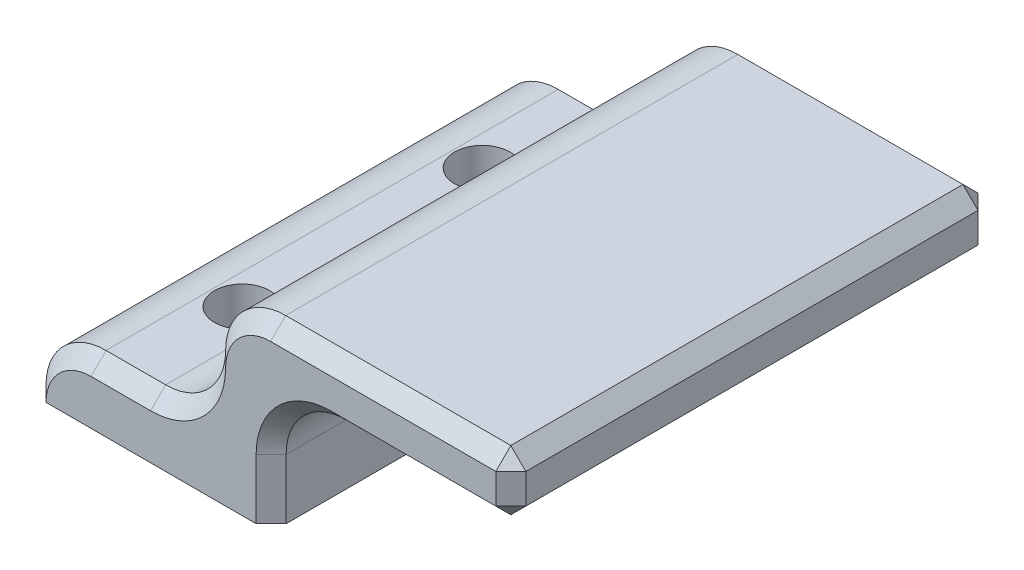
from build123d import *

# Parameters (mm, degrees)
BOSS_EXTRUDE1_DEPTH = 25.5
SKETCH3_R           = 2.921
CUT_EXTRUDE1_DEPTH  = 41.331656301
FILLET1_START       = -25.5
FILLET1_DEPTH       = 51
FILLET1_2_DEPTH     = 51
CHAMFER1_SIZE       = 1.5875


with BuildPart() as part:
    # Sketch1 → Boss-Extrude1 (new, symmetric)
    with BuildSketch(Plane.XY):
        Polygon((-22.2, -9.525), (3.2, -9.525), (3.2, 3.175), (28.55, 3.175), (28.55, 9.525), (-3.2, 9.525), (-3.2, -3.175), (-22.2, -3.175), align=None)
    extrude(amount=BOSS_EXTRUDE1_DEPTH, both=True)

    # Sketch3 → Cut-Extrude1 (cut, through all)
    with BuildSketch(Plane(origin=(0, -3.175, 0), x_dir=(1, 0, 0), z_dir=(0, 1, 0))):
        with Locations(Location((-12.675, -12.7, 0), (0, 0, 180))):
            Circle(SKETCH3_R)
    cut_extrude1 = extrude(amount=-CUT_EXTRUDE1_DEPTH, mode=Mode.SUBTRACT)

    # Mirror1: Cut-Extrude1 across plane
    add(cut_extrude1.mirror(Plane.XY), mode=Mode.SUBTRACT)

    # Fillet1: read off the stored shape, not the designer's step
    # Fillet1 outline → Fillet1 (cut)
    with BuildSketch(Plane.XY.offset(FILLET1_START)):
        with BuildLine():
            Line((-22.2, -3.175), (-22.2, -9.525))
            ThreePointArc((-22.2, -9.525), (-20.340128061, -5.034871939), (-15.85, -3.175))
            Line((-15.85, -3.175), (-22.2, -3.175))
        make_face()
        with BuildLine():
            Line((-3.2, 9.525), (-3.2, 3.175))
            ThreePointArc((-3.2, 3.175), (-1.340128061, 7.665128061), (3.15, 9.525))
            Line((3.15, 9.525), (-3.2, 9.525))
        make_face()
    extrude(amount=FILLET1_DEPTH, mode=Mode.SUBTRACT)

    # Fillet1 2 outline → Fillet1 2 (add)
    with BuildSketch(Plane.XY.offset(FILLET1_START)):
        with BuildLine():
            ThreePointArc((3.2, -3.175), (5.059871939, 1.315128061), (9.55, 3.175))
            Line((9.55, 3.175), (3.2, 3.175))
            Line((3.2, 3.175), (3.2, -3.175))
        make_face()
        with BuildLine():
            ThreePointArc((-3.2, 3.175), (-5.059871939, -1.315128061), (-9.55, -3.175))
            Line((-9.55, -3.175), (-3.2, -3.175))
            Line((-3.2, -3.175), (-3.2, 3.175))
        make_face()
    extrude(amount=FILLET1_2_DEPTH)

    # Chamfer1
    chamfer1_edges = [part.edges().sort_by_distance(p)[0] for p in [
        (3.2, -6.35, -25.5),
        (3.2, -6.35, 25.5),
        (28.55, 9.525, 0),
        (28.55, 3.175, 0),
        (28.55, 6.35, 25.5),
        (15.85, 9.525, 25.5),
        (19.05, 3.175, -25.5),
        (19.05, 3.175, 25.5),
        (-12.7, -3.175, -25.5),
        (-1.340128061, 7.665128061, -25.5),
        (-20.340128061, -5.034871939, -25.5),
        (-12.7, -3.175, 25.5),
        (-1.340128061, 7.665128061, 25.5),
        (-20.340128061, -5.034871939, 25.5),
        (5.059871939, 1.315128061, -25.5),
        (5.059871939, 1.315128061, 25.5),
        (-5.059871939, -1.315128061, -25.5),
        (-5.059871939, -1.315128061, 25.5),
        (15.85, 9.525, -25.5),
        (28.55, 6.35, -25.5),
    ]]
    chamfer(chamfer1_edges, length=CHAMFER1_SIZE)


solid = part.part
